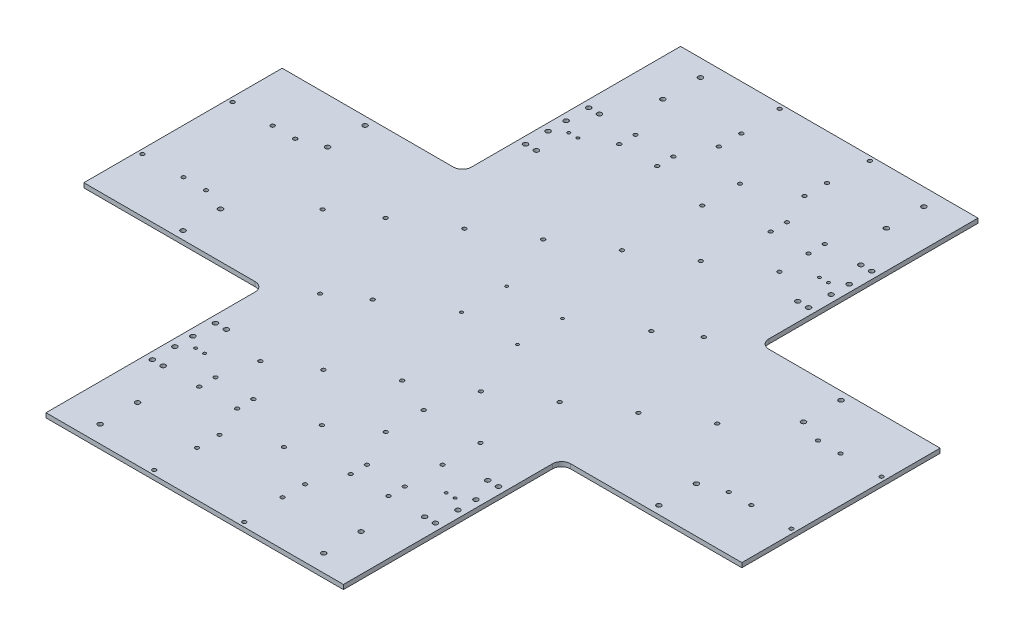
from build123d import *

# Parameters (mm, degrees)
BOSS_EXTRUDE1_DEPTH = 5
SKETCH2_R           = 2.125
CUT_EXTRUDE1_DEPTH  = 3
SKETCH4_R           = 2.6
SKETCH4_R_2         = 1.6
CUT_EXTRUDE3_DEPTH  = 10
SKETCH5_R           = 2.125
CUT_EXTRUDE4_DEPTH  = 10
FILLET1_R           = 10
SKETCH6_R           = 2.6
CUT_EXTRUDE5_DEPTH  = 10
SKETCH7_R           = 2.125
CUT_EXTRUDE6_DEPTH  = 10
SKETCH8_R           = 2.1
CUT_EXTRUDE7_DEPTH  = 10
SKETCH9_R           = 1.575
CUT_EXTRUDE8_DEPTH  = 10
SKETCH11_R          = 2.125
CUT_EXTRUDE9_DEPTH  = 10
SKETCH12_R          = 2.125
CUT_EXTRUDE10_DEPTH = 10


with BuildPart() as part:
    # Sketch1 → Boss-Extrude1 (new body)
    with BuildSketch(Plane(origin=(0, 0, 0), x_dir=(1, 0, 0), z_dir=(0, 1, 0))):
        Polygon((165, 352), (-165, 352), (-165, 110), (-365, 110), (-365, -110), (-165, -110), (-165, -352), (165, -352), (165, -110), (365, -110), (365, 110), (165, 110), align=None)
    extrude(amount=BOSS_EXTRUDE1_DEPTH)

    # Sketch2 → Cut-Extrude1 (cut)
    with BuildSketch(Plane(origin=(0, 5, 0), x_dir=(1, 0, 0), z_dir=(0, 1, 0))):
        with Locations((315, 49.5)):
            Circle(SKETCH2_R)
        with Locations((290, 49.5)):
            Circle(SKETCH2_R)
        with Locations((290, -49.5)):
            Circle(SKETCH2_R)
        with Locations((315, -49.5)):
            Circle(SKETCH2_R)
        with Locations((-315, -49.5)):
            Circle(SKETCH2_R)
        with Locations((-290, -49.5)):
            Circle(SKETCH2_R)
        with Locations((-290, 49.5)):
            Circle(SKETCH2_R)
        with Locations((-315, 49.5)):
            Circle(SKETCH2_R)
        with Locations((47.5, 302)):
            Circle(SKETCH2_R)
        with Locations((47.5, 277)):
            Circle(SKETCH2_R)
        with Locations((-47.5, 277)):
            Circle(SKETCH2_R)
        with Locations((-47.5, 302)):
            Circle(SKETCH2_R)
        with Locations((-47.5, -302)):
            Circle(SKETCH2_R)
        with Locations((-47.5, -277)):
            Circle(SKETCH2_R)
        with Locations((47.5, -277)):
            Circle(SKETCH2_R)
        with Locations((47.5, -302)):
            Circle(SKETCH2_R)
    extrude(amount=-CUT_EXTRUDE1_DEPTH, mode=Mode.SUBTRACT)

    # Sketch4 → Cut-Extrude3 (cut)
    with BuildSketch(Plane(origin=(0, 5, 0), x_dir=(1, 0, 0), z_dir=(0, 1, 0))):
        with Locations((-157, 172)):
            Circle(SKETCH4_R)
        with Locations((-145, 172)):
            Circle(SKETCH4_R)
        with Locations((-157, 197)):
            Circle(SKETCH4_R)
        with Locations((-157, 217)):
            Circle(SKETCH4_R)
        with Locations((-157, 242)):
            Circle(SKETCH4_R)
        with Locations((-145, 242)):
            Circle(SKETCH4_R)
        with Locations((145, 242)):
            Circle(SKETCH4_R)
        with Locations((157, 242)):
            Circle(SKETCH4_R)
        with Locations((157, 217)):
            Circle(SKETCH4_R)
        with Locations((157, 197)):
            Circle(SKETCH4_R)
        with Locations((145, 172)):
            Circle(SKETCH4_R)
        with Locations((157, 172)):
            Circle(SKETCH4_R)
        with Locations((157, -172)):
            Circle(SKETCH4_R)
        with Locations((145, -172)):
            Circle(SKETCH4_R)
        with Locations((157, -197)):
            Circle(SKETCH4_R)
        with Locations((157, -217)):
            Circle(SKETCH4_R)
        with Locations((157, -242)):
            Circle(SKETCH4_R)
        with Locations((145, -242)):
            Circle(SKETCH4_R)
        with Locations((-145, -242)):
            Circle(SKETCH4_R)
        with Locations((-157, -242)):
            Circle(SKETCH4_R)
        with Locations((-157, -217)):
            Circle(SKETCH4_R)
        with Locations((-157, -197)):
            Circle(SKETCH4_R)
        with Locations((-145, -172)):
            Circle(SKETCH4_R)
        with Locations((-157, -172)):
            Circle(SKETCH4_R)
        with Locations((144, -207)):
            Circle(SKETCH4_R_2)
        with Locations((-144, -207)):
            Circle(SKETCH4_R_2)
        with Locations((144, 207)):
            Circle(SKETCH4_R_2)
        with Locations((-144, 207)):
            Circle(SKETCH4_R_2)
        with Locations((134, -207)):
            Circle(SKETCH4_R_2)
        with Locations((-134, -207)):
            Circle(SKETCH4_R_2)
        with Locations((134, 207)):
            Circle(SKETCH4_R_2)
        with Locations((-134, 207)):
            Circle(SKETCH4_R_2)
    extrude(amount=-CUT_EXTRUDE3_DEPTH, mode=Mode.SUBTRACT)

    # Sketch5 → Cut-Extrude4 (cut)
    with BuildSketch(Plane(origin=(0, 5, 0), x_dir=(1, 0, 0), z_dir=(0, 1, 0))):
        with Locations((-50, 347)):
            Circle(SKETCH5_R)
        with Locations((50, 347)):
            Circle(SKETCH5_R)
        with Locations((50, -347)):
            Circle(SKETCH5_R)
        with Locations((-50, -347)):
            Circle(SKETCH5_R)
        with Locations((-360, 50)):
            Circle(SKETCH5_R)
        with Locations((-360, -50)):
            Circle(SKETCH5_R)
        with Locations((360, -50)):
            Circle(SKETCH5_R)
        with Locations((360, 50)):
            Circle(SKETCH5_R)
    extrude(amount=-CUT_EXTRUDE4_DEPTH, mode=Mode.SUBTRACT)

    # Fillet1
    fillet1_edges = [part.edges().sort_by_distance(p)[0] for p in [
        (-165, 2.5, -110),
        (-165, 2.5, 110),
        (165, 2.5, 110),
        (165, 2.5, -110),
    ]]
    fillet(fillet1_edges, radius=FILLET1_R)

    # Sketch6 → Cut-Extrude5 (cut)
    with BuildSketch(Plane(origin=(0, 5, 0), x_dir=(1, 0, 0), z_dir=(0, 1, 0))):
        with Locations((124, 333)):
            Circle(SKETCH6_R)
        with Locations((124, 291.4)):
            Circle(SKETCH6_R)
        with Locations((124, -291.4)):
            Circle(SKETCH6_R)
        with Locations((124, -333)):
            Circle(SKETCH6_R)
        with Locations((-124, -333)):
            Circle(SKETCH6_R)
        with Locations((-124, -291.4)):
            Circle(SKETCH6_R)
        with Locations((-124, 291.4)):
            Circle(SKETCH6_R)
        with Locations((-124, 333)):
            Circle(SKETCH6_R)
        with Locations((264, 101)):
            Circle(SKETCH6_R)
        with Locations((264, 59.4)):
            Circle(SKETCH6_R)
        with Locations((264, -59.4)):
            Circle(SKETCH6_R)
        with Locations((264, -101)):
            Circle(SKETCH6_R)
        with Locations((-264, -101)):
            Circle(SKETCH6_R)
        with Locations((-264, -59.4)):
            Circle(SKETCH6_R)
        with Locations((-264, 59.4)):
            Circle(SKETCH6_R)
        with Locations((-264, 101)):
            Circle(SKETCH6_R)
    extrude(amount=-CUT_EXTRUDE5_DEPTH, mode=Mode.SUBTRACT)

    # Sketch7 → Cut-Extrude6 (cut)
    with BuildSketch(Plane(origin=(0, 5, 0), x_dir=(1, 0, 0), z_dir=(0, 1, 0))):
        with Locations((-55.682048102, 90.197059371)):
            Circle(SKETCH7_R)
        with Locations((-1.648904044, 123.553757998)):
            Circle(SKETCH7_R)
        with Locations((52.384240013, 156.910456625)):
            Circle(SKETCH7_R)
        with Locations((106.41738407, 190.267155252)):
            Circle(SKETCH7_R)
        with Locations((-109.715192159, 56.840360744)):
            Circle(SKETCH7_R)
        with Locations((-163.748336216, 23.483662117)):
            Circle(SKETCH7_R)
        with Locations((-206.974851462, -3.201696784)):
            Circle(SKETCH7_R)
        with Locations((-95.610755259, -183.595815527)):
            Circle(SKETCH7_R)
        with Locations((-52.384240013, -156.910456625)):
            Circle(SKETCH7_R)
        with Locations((1.648904044, -123.553757998)):
            Circle(SKETCH7_R)
        with Locations((217.781480273, 9.87303651)):
            Circle(SKETCH7_R)
        with Locations((163.748336216, -23.483662117)):
            Circle(SKETCH7_R)
        with Locations((109.715192159, -56.840360744)):
            Circle(SKETCH7_R)
        with Locations((55.682048102, -90.197059371)):
            Circle(SKETCH7_R)
    extrude(amount=-CUT_EXTRUDE6_DEPTH, mode=Mode.SUBTRACT)

    # Sketch8 → Cut-Extrude7 (cut)
    with BuildSketch(Plane(origin=(0, 5, 0), x_dir=(1, 0, 0), z_dir=(0, 1, 0))):
        with Locations((-127.267902287, -85.585182493)):
            Circle(SKETCH8_R)
        with Locations((-92.415590944, -62.147682754)):
            Circle(SKETCH8_R)
        with Locations((92.415590944, 62.147682754)):
            Circle(SKETCH8_R)
        with Locations((127.267902287, 85.585182493)):
            Circle(SKETCH8_R)
        with Locations((0, 253)):
            Circle(SKETCH8_R)
        with Locations((0, 211)):
            Circle(SKETCH8_R)
        with Locations((0, -211)):
            Circle(SKETCH8_R)
        with Locations((0, -253)):
            Circle(SKETCH8_R)
    extrude(amount=-CUT_EXTRUDE7_DEPTH, mode=Mode.SUBTRACT)

    # Sketch9 → Cut-Extrude8 (cut)
    with BuildSketch(Plane(origin=(0, 5, 0), x_dir=(1, 0, 0), z_dir=(0, 1, 0))):
        with Locations((-31, 25)):
            Circle(SKETCH9_R)
        with Locations((-31, -25)):
            Circle(SKETCH9_R)
        with Locations((31, -25)):
            Circle(SKETCH9_R)
        with Locations((31, 25)):
            Circle(SKETCH9_R)
    extrude(amount=-CUT_EXTRUDE8_DEPTH, mode=Mode.SUBTRACT)

    # Sketch11 → Cut-Extrude9 (cut)
    with BuildSketch(Plane(origin=(0, 5, 0), x_dir=(1, 0, 0), z_dir=(0, 1, 0))):
        with Locations((63, 242)):
            Circle(SKETCH11_R)
        with Locations((63, 224)):
            Circle(SKETCH11_R)
        with Locations((105, 242)):
            Circle(SKETCH11_R)
        with Locations((105, 224)):
            Circle(SKETCH11_R)
        with Locations((-105, 224)):
            Circle(SKETCH11_R)
        with Locations((-105, 242)):
            Circle(SKETCH11_R)
        with Locations((-63, 224)):
            Circle(SKETCH11_R)
        with Locations((-63, 242)):
            Circle(SKETCH11_R)
        with Locations((-63, -242)):
            Circle(SKETCH11_R)
        with Locations((-63, -224)):
            Circle(SKETCH11_R)
        with Locations((-105, -242)):
            Circle(SKETCH11_R)
        with Locations((-105, -224)):
            Circle(SKETCH11_R)
        with Locations((105, -224)):
            Circle(SKETCH11_R)
        with Locations((105, -242)):
            Circle(SKETCH11_R)
        with Locations((63, -224)):
            Circle(SKETCH11_R)
        with Locations((63, -242)):
            Circle(SKETCH11_R)
    extrude(amount=-CUT_EXTRUDE9_DEPTH, mode=Mode.SUBTRACT)

    # Sketch12 → Cut-Extrude10 (cut)
    with BuildSketch(Plane(origin=(0, 5, 0), x_dir=(1, 0, 0), z_dir=(0, 1, 0))):
        with Locations((42, -140)):
            Circle(SKETCH12_R)
        with Locations((105, -140)):
            Circle(SKETCH12_R)
        with Locations((42, -182)):
            Circle(SKETCH12_R)
        with Locations((105, -182)):
            Circle(SKETCH12_R)
    extrude(amount=-CUT_EXTRUDE10_DEPTH, mode=Mode.SUBTRACT)


solid = part.part
